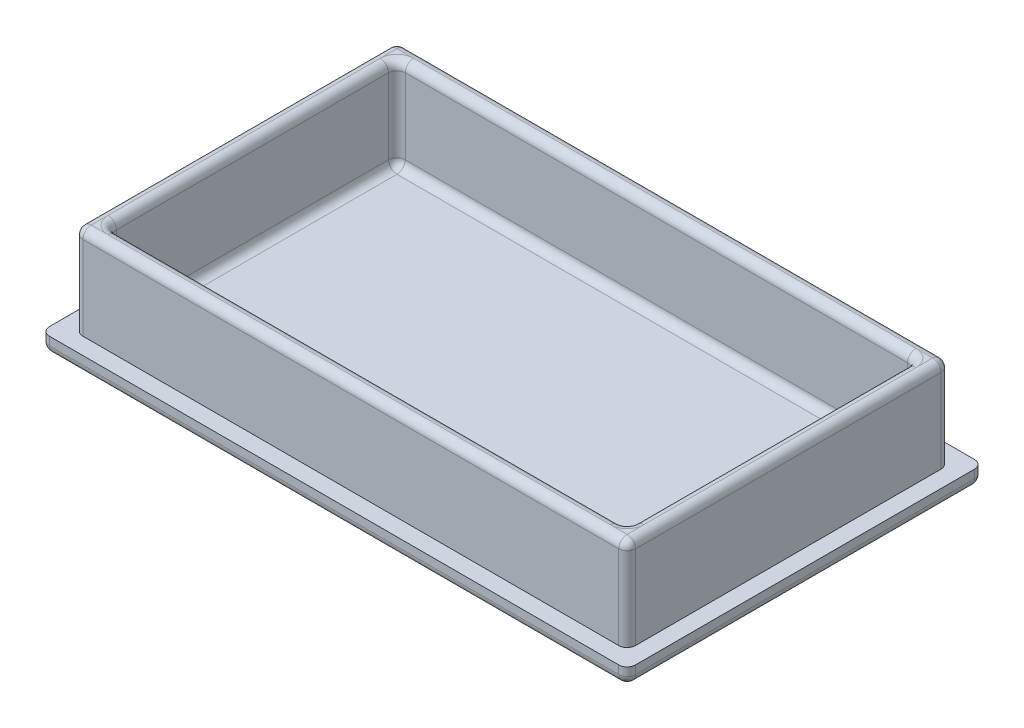
from build123d import *

# Parameters (mm, degrees)
SKETCH1_W           = 70
SKETCH1_H           = 42.5
BOSS_EXTRUDE1_DEPTH = 2
SKETCH2_W           = 66
SKETCH2_H           = 38.5
SKETCH2_W_2         = 62
SKETCH2_H_2         = 34.5
BOSS_EXTRUDE2_DEPTH = 11
FILLET1_R           = 1
SKETCH3_R           = 5
CUT_EXTRUDE1_DEPTH  = 0.5


with BuildPart() as part:
    # Sketch1 → Boss-Extrude1 (new body)
    with BuildSketch(Plane(origin=(0, 0, 0), x_dir=(1, 0, 0), z_dir=(0, 1, 0))):
        Rectangle(SKETCH1_W, SKETCH1_H)
    extrude(amount=-BOSS_EXTRUDE1_DEPTH)

    # Sketch2 → Boss-Extrude2 (add)
    with BuildSketch(Plane(origin=(0, 0, 0), x_dir=(-1, 0, 0), z_dir=(0, 1, 0))):
        Rectangle(SKETCH2_W, SKETCH2_H)
        Rectangle(SKETCH2_W_2, SKETCH2_H_2, mode=Mode.SUBTRACT)
    extrude(amount=BOSS_EXTRUDE2_DEPTH)

    # Fillet1
    fillet1_edges = [part.edges().sort_by_distance(p)[0] for p in [
        (35, -2, 0),
        (0, -2, -21.25),
        (0, 0, -17.25),
        (-31, 5.5, -17.25),
        (31, 0, 0),
        (31, 5.5, -17.25),
        (0, 11, 17.25),
        (31, 5.5, 17.25),
        (-33, 5.5, 19.25),
        (33, 5.5, 19.25),
        (0, 11, -19.25),
        (33, 5.5, -19.25),
        (-33, 11, 0),
        (-33, 5.5, -19.25),
        (-31, 11, 0),
        (-31, 5.5, 17.25),
        (0, 11, 19.25),
        (33, 11, 0),
        (0, 11, -17.25),
        (31, 11, 0),
        (-31, 0, 0),
        (0, 0, 17.25),
        (-35, -2, 0),
        (-35, -1, -21.25),
        (35, -1, -21.25),
        (35, -1, 21.25),
        (-35, -1, 21.25),
        (0, -2, 21.25),
    ]]
    fillet(fillet1_edges, radius=FILLET1_R - 0.0001)  # a hair under: the kernel refuses the full size

    # Sketch3 → Cut-Extrude1 (cut)
    with BuildSketch(Plane.XZ.offset(2)):
        with BuildLine():
            ThreePointArc((12.000000021, 8.999999972), (8.499999983, 9.499999987), (8.000000047, 5.999999937))
            ThreePointArc((8.000000047, 5.999999937), (10, -3.8e-08), (8.000000001, -5.999999998))
            ThreePointArc((8.000000001, -5.999999998), (8.499999982, -9.499999987), (11.999999975, -9.000000033))
            ThreePointArc((11.999999975, -9.000000033), (15, -3.8e-08), (12.000000021, 8.999999972))
        make_face()
        with Locations(Location((0, 0, 0), (0, 0, 270))):
            Circle(SKETCH3_R)
        with BuildLine():
            ThreePointArc((-8.000000081, -5.999999892), (-10, -1.9e-08), (-8.000000104, 5.999999861))
            ThreePointArc((-8.000000104, 5.999999861), (-8.499999944, 9.499999958), (-12.000000021, 8.999999972))
            ThreePointArc((-12.000000021, 8.999999972), (-15, 3.8e-08), (-12.000000067, -8.999999911))
            ThreePointArc((-12.000000067, -8.999999911), (-8.49999999, -9.499999993), (-8.000000081, -5.999999892))
        make_face()
        with BuildLine():
            ThreePointArc((16.62958836, 11.111111149), (20, -3.3e-08), (16.629588323, -11.111111204))
            ThreePointArc((16.629588323, -11.111111204), (17.319398074, -14.578698568), (20.786985459, -13.888888924))
            ThreePointArc((20.786985459, -13.888888924), (25, -2.4e-08), (20.786985486, 13.888888883))
            ThreePointArc((20.786985486, 13.888888883), (17.319398067, 14.578698563), (16.62958836, 11.111111149))
        make_face()
        with BuildLine():
            ThreePointArc((-16.629588323, -11.111111204), (-20, 2.3e-08), (-16.629588298, 11.111111242))
            ThreePointArc((-16.629588298, 11.111111242), (-17.319398098, 14.578698584), (-20.786985465, 13.888888914))
            ThreePointArc((-20.786985465, 13.888888914), (-25, -1.1e-08), (-20.786985453, -13.888888933))
            ThreePointArc((-20.786985453, -13.888888933), (-17.31939807, -14.578698565), (-16.629588323, -11.111111204))
        make_face()
    extrude(amount=-CUT_EXTRUDE1_DEPTH, mode=Mode.SUBTRACT)


solid = part.part
